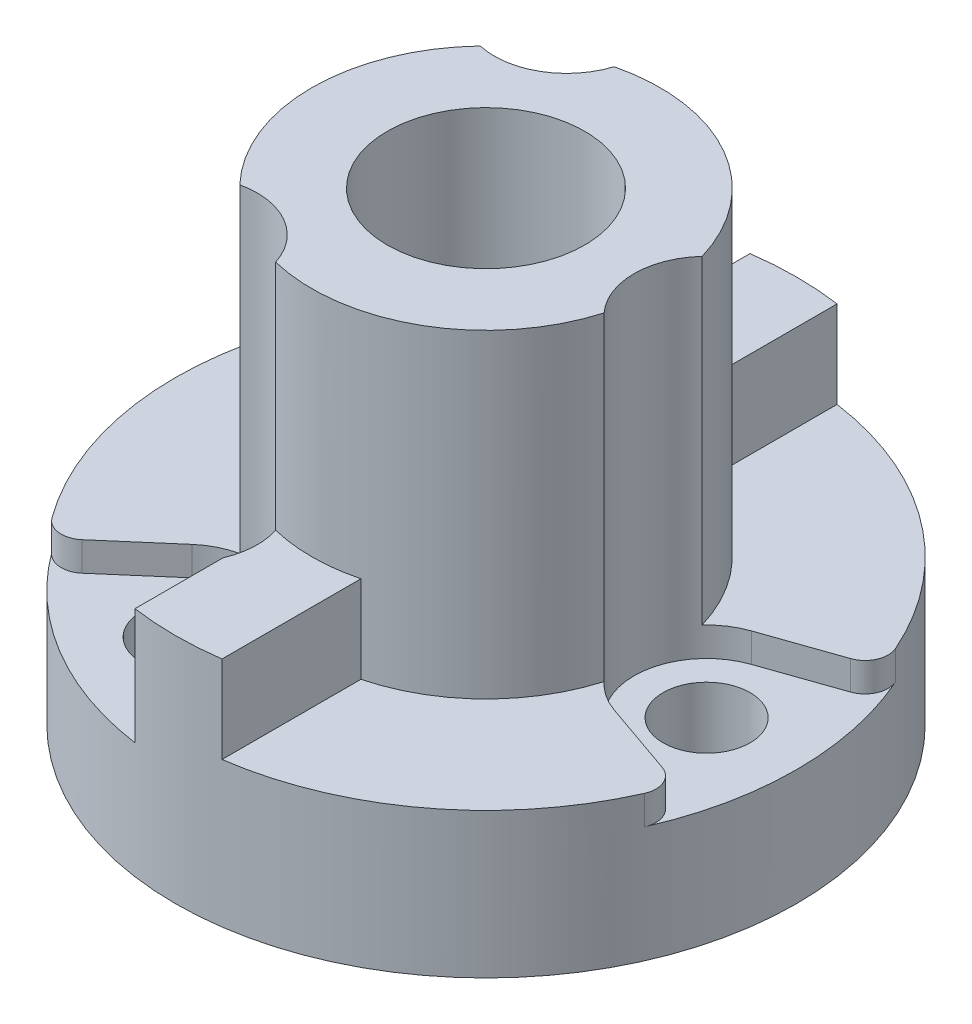
from build123d import *
from build123d.topology import SkipClean

# Parameters (mm, degrees)
SKETCH1_R           = 5.35
BOSS_EXTRUDE1_DEPTH = 2.5
HOLE1_OUTLINE_R     = 1.7
HOLE1_DEPTH         = 2.5
SKETCH3_R           = 3
SKETCH3_R_2         = 1.7
BOSS_EXTRUDE2_DEPTH = 10
FILLET1_R           = 0.1
BOSS_EXTRUDE3_DEPTH = 1.5
SKETCH8_R           = 0.75
CUT_EXTRUDE1_DEPTH  = 13.539736839
CUT_EXTRUDE3_START  = -0.5
SKETCH13_R          = 1.25
CUT_EXTRUDE3_DEPTH  = 7
CHAMFER1_SIZE       = 0.25
CUT_EXTRUDE4_START  = -0.5
CUT_EXTRUDE4_DEPTH  = 0.5
FILLET2_R           = 0.4
CUT_EXTRUDE5_START  = -4.5
SKETCH15_R          = 3
CUT_EXTRUDE5_DEPTH  = 4.5


# Read off the part's stored shape, not the designer's step: Hole1
with BuildPart() as part:
    # Sketch1 → Boss-Extrude1 (new body)
    with BuildSketch(Plane(origin=(0, 0, 0), x_dir=(1, 0, 0), z_dir=(0, 1, 0))):
        with Locations(Location((0, 0, 0), (0, 0, 270))):
            Circle(SKETCH1_R)
    extrude(amount=BOSS_EXTRUDE1_DEPTH)

    # Hole1 outline → Hole1 (cut)
    with BuildSketch(Plane(origin=(0, 0, 0), x_dir=(1, 0, 0), z_dir=(0, 1, 0))):
        Circle(HOLE1_OUTLINE_R)
    extrude(amount=HOLE1_DEPTH, mode=Mode.SUBTRACT)

    # Sketch3 → Boss-Extrude2 (add)
    with BuildSketch(Plane(origin=(0, 2.5, 0), x_dir=(1, 0, 0), z_dir=(0, 1, 0))):
        with Locations(Location((0, 0, 0), (0, 0, 270))):
            Circle(SKETCH3_R)
        with Locations(Location((0, 0, 0), (0, 0, 270))):
            Circle(SKETCH3_R_2, mode=Mode.SUBTRACT)
    extrude(amount=BOSS_EXTRUDE2_DEPTH)

    # Fillet1
    fillet1_edges = [part.edges().sort_by_distance(p)[0] for p in [
        (0, 12.5, -3),
    ]]
    fillet(fillet1_edges, radius=FILLET1_R)

    # Sketch5 → Boss-Extrude3 (add)
    with BuildSketch(Plane(origin=(0, 2.5, 0), x_dir=(1, 0, 0), z_dir=(0, 1, 0))):
        with BuildLine():
            Line((-0.75, 5.297169055), (-0.75, 2.90473751))
            ThreePointArc((-0.75, 2.90473751), (0, 3), (0.75, 2.90473751))
            Line((0.75, 2.90473751), (0.75, 5.297169055))
            ThreePointArc((0.75, 5.297169055), (0, 5.35), (-0.75, 5.297169055))
        make_face()
    boss_extrude3 = extrude(amount=BOSS_EXTRUDE3_DEPTH)

    # Mirror1: Boss-Extrude3 across plane
    with SkipClean():  # the faces are left unmerged after this step: merging them gives an invalid solid
        add(boss_extrude3.mirror(Plane.XY))

    # Sketch8 → Cut-Extrude1 (cut, through all)
    with SkipClean():  # the faces are left unmerged after this step: merging them gives an invalid solid
        with BuildSketch(Plane(origin=(0, 2.5, 0), x_dir=(1, 0, 0), z_dir=(0, 1, 0))):
            with Locations(Location((3.8, 0, 0), (0, 0, 270))):
                Circle(SKETCH8_R)
            with Locations(Location((-1.9, -3.290896534, 0), (0, 0, 270))):
                Circle(SKETCH8_R)
            with Locations(Location((-1.9, 3.290896534, 0), (0, 0, 270))):
                Circle(SKETCH8_R)
        extrude(amount=-CUT_EXTRUDE1_DEPTH, mode=Mode.SUBTRACT)

    # Sketch13 → Cut-Extrude3 (cut)
    with SkipClean():  # the faces are left unmerged after this step: merging them gives an invalid solid
        with BuildSketch(Plane(origin=(0, 2.5, 0), x_dir=(1, 0, 0), z_dir=(0, 1, 0)).offset(CUT_EXTRUDE3_START)):
            with Locations(Location((-1.9, 3.290896534, 0), (0, 0, 23.073918066))):
                Circle(SKETCH13_R)
            with Locations(Location((-1.9, -3.290896534, 0), (0, 0, 102.514591278))):
                Circle(SKETCH13_R)
            with Locations(Location((3.8, 0, 0), (0, 0, 137.485408722))):
                Circle(SKETCH13_R)
        extrude(amount=CUT_EXTRUDE3_DEPTH, mode=Mode.SUBTRACT)

    # Chamfer1
    chamfer1_edges = [part.edges().sort_by_distance(p)[0] for p in [
        (-1.275, 9, -2.20836478),
        (-1.275, 9, 2.20836478),
        (2.55, 9, 0),
    ]]
    chamfer(chamfer1_edges, length=CHAMFER1_SIZE)

    # Sketch14 → Cut-Extrude4 (cut)
    with BuildSketch(Plane(origin=(0, 2.5, 0), x_dir=(1, 0, 0), z_dir=(0, 1, 0)).offset(CUT_EXTRUDE4_START)):
        with BuildLine():
            Line((-0.75, -3.780794483), (-0.75, -5.297169055))
            ThreePointArc((-0.75, -5.297169055), (-2.563606422, -4.695787699), (-4.050222345, -3.495454041))
            Line((-4.050222345, -3.495454041), (-2.716694869, -2.344582902))
            ThreePointArc((-2.716694869, -2.344582902), (-2.637189937, -4.300377092), (-0.75, -3.780794483))
        make_face()
        with BuildLine():
            Line((-0.75, 5.297169055), (-0.75, 3.780794483))
            ThreePointArc((-0.75, 3.780794483), (-2.637189937, 4.300377092), (-2.716694869, 2.344582902))
            Line((-2.716694869, 2.344582902), (-4.050222345, 3.495454041))
            ThreePointArc((-4.050222345, 3.495454041), (-2.563606422, 4.695787699), (-0.75, 5.297169055))
        make_face()
        with BuildLine():
            Line((3.388815789, -1.18043532), (5.05226317, -1.759868421))
            ThreePointArc((5.05226317, -1.759868421), (5.35, 0), (5.05226317, 1.759868421))
            Line((5.05226317, 1.759868421), (3.388815789, 1.18043532))
            ThreePointArc((3.388815789, 1.18043532), (5.05, 0), (3.388815789, -1.18043532))
        make_face()
    extrude(amount=CUT_EXTRUDE4_DEPTH, mode=Mode.SUBTRACT)

    # Fillet2
    fillet2_edges = [part.edges().sort_by_distance(p)[0] for p in [
        (-4.050222345, 2.25, -3.495454041),
        (-4.050222345, 2.25, 3.495454041),
        (5.05226317, 2.25, -1.759868421),
        (5.05226317, 2.25, 1.759868421),
    ]]
    fillet(fillet2_edges, radius=FILLET2_R)

    # Sketch15 → Cut-Extrude5 (cut)
    with BuildSketch(Plane(origin=(0, 12.5, 0), x_dir=(1, 0, 0), z_dir=(0, 1, 0)).offset(CUT_EXTRUDE5_START)):
        Circle(SKETCH15_R)
    extrude(amount=CUT_EXTRUDE5_DEPTH, mode=Mode.SUBTRACT)


solid = part.part
